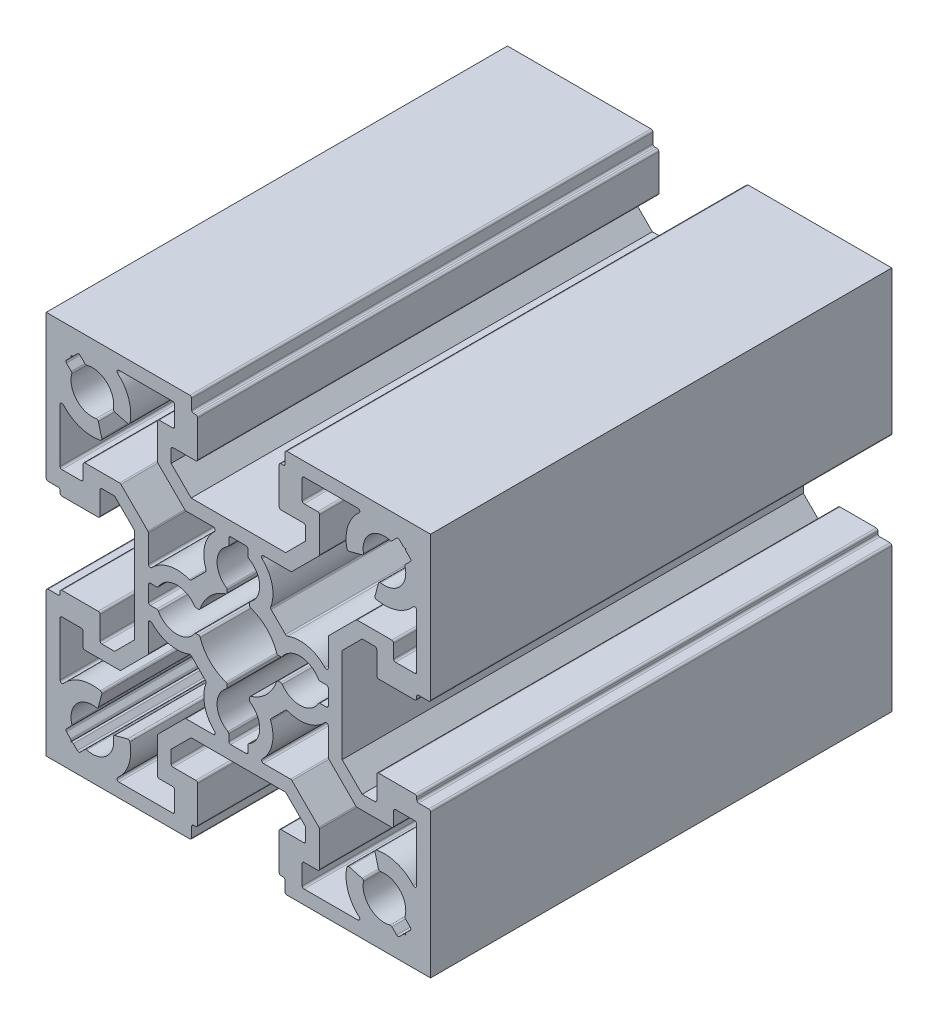
from build123d import *

# Parameters (mm, degrees)
Y_KSEKLIK_EKSTR_ZYON1_DEPTH = 60


with BuildPart() as part:
    # Çizim3 → Yükseklik-Ekstrüzyon1 (new body)
    with BuildSketch(Plane.XY):
        with BuildLine():
            Line((6.075, -23.45), (6.075, -24.75))
            ThreePointArc((6.075, -24.75), (6.148223305, -24.926776695), (6.325, -25))
            Line((6.325, -25), (25, -25))
            Line((25, -25), (25, -6.325))
            ThreePointArc((25, -6.325), (24.926776695, -6.148223305), (24.75, -6.075))
            Line((24.75, -6.075), (23.45, -6.075))
            ThreePointArc((23.45, -6.075), (23.273223305, -6.001776695), (23.2, -5.825))
            Line((23.2, -5.825), (23.2, -5.55))
            ThreePointArc((23.2, -5.55), (23.126776695, -5.373223305), (22.95, -5.3))
            Line((22.95, -5.3), (18.25, -5.3))
            ThreePointArc((18.25, -5.3), (18.073223305, -5.373223305), (18, -5.55))
            Line((18, -5.55), (18, -8.5))
            ThreePointArc((18, -8.5), (17.926776695, -8.676776695), (17.75, -8.75))
            Line((17.75, -8.75), (16.1, -8.75))
            Line((16.1, -8.75), (13.5, -6.15))
            Line((13.5, -6.15), (13.5, 6.15))
            Line((13.5, 6.15), (16.1, 8.75))
            Line((16.1, 8.75), (17.75, 8.75))
            ThreePointArc((17.75, 8.75), (17.926776695, 8.676776695), (18, 8.5))
            Line((18, 8.5), (18, 5.55))
            ThreePointArc((18, 5.55), (18.073223305, 5.373223305), (18.25, 5.3))
            Line((18.25, 5.3), (22.95, 5.3))
            ThreePointArc((22.95, 5.3), (23.126776695, 5.373223305), (23.2, 5.55))
            Line((23.2, 5.55), (23.2, 5.825))
            ThreePointArc((23.2, 5.825), (23.273223305, 6.001776695), (23.45, 6.075))
            Line((23.45, 6.075), (24.75, 6.075))
            ThreePointArc((24.75, 6.075), (24.926776695, 6.148223305), (25, 6.325))
            Line((25, 6.325), (25, 25))
            Line((25, 25), (6.325, 25))
            ThreePointArc((6.325, 25), (6.148223305, 24.926776695), (6.075, 24.75))
            Line((6.075, 24.75), (6.075, 23.45))
            ThreePointArc((6.075, 23.45), (6.001776695, 23.273223305), (5.825, 23.2))
            Line((5.825, 23.2), (5.55, 23.2))
            ThreePointArc((5.55, 23.2), (5.373223305, 23.126776695), (5.3, 22.95))
            Line((5.3, 22.95), (5.3, 18.25))
            ThreePointArc((5.3, 18.25), (5.373223305, 18.073223305), (5.55, 18))
            Line((5.55, 18), (8.5, 18))
            ThreePointArc((8.5, 18), (8.676776695, 17.926776695), (8.75, 17.75))
            Line((8.75, 17.75), (8.75, 16.1))
            Line((8.75, 16.1), (6.15, 13.5))
            Line((6.15, 13.5), (-6.15, 13.5))
            Line((-6.15, 13.5), (-8.75, 16.1))
            Line((-8.75, 16.1), (-8.75, 17.75))
            ThreePointArc((-8.75, 17.75), (-8.676776695, 17.926776695), (-8.5, 18))
            Line((-8.5, 18), (-5.55, 18))
            ThreePointArc((-5.55, 18), (-5.373223305, 18.073223305), (-5.3, 18.25))
            Line((-5.3, 18.25), (-5.3, 22.95))
            ThreePointArc((-5.3, 22.95), (-5.373223305, 23.126776695), (-5.55, 23.2))
            Line((-5.55, 23.2), (-5.825, 23.2))
            ThreePointArc((-5.825, 23.2), (-6.001776695, 23.273223305), (-6.075, 23.45))
            Line((-6.075, 23.45), (-6.075, 24.75))
            ThreePointArc((-6.075, 24.75), (-6.148223305, 24.926776695), (-6.325, 25))
            Line((-6.325, 25), (-25, 25))
            Line((-25, 25), (-25, 6.325))
            ThreePointArc((-25, 6.325), (-24.926776695, 6.148223305), (-24.75, 6.075))
            Line((-24.75, 6.075), (-23.45, 6.075))
            ThreePointArc((-23.45, 6.075), (-23.273223305, 6.001776695), (-23.2, 5.825))
            Line((-23.2, 5.825), (-23.2, 5.55))
            ThreePointArc((-23.2, 5.55), (-23.126776695, 5.373223305), (-22.95, 5.3))
            Line((-22.95, 5.3), (-18.25, 5.3))
            ThreePointArc((-18.25, 5.3), (-18.073223305, 5.373223305), (-18, 5.55))
            Line((-18, 5.55), (-18, 8.5))
            ThreePointArc((-18, 8.5), (-17.926776695, 8.676776695), (-17.75, 8.75))
            Line((-17.75, 8.75), (-16.1, 8.75))
            Line((-16.1, 8.75), (-13.5, 6.15))
            Line((-13.5, 6.15), (-13.5, -6.15))
            Line((-13.5, -6.15), (-16.1, -8.75))
            Line((-16.1, -8.75), (-17.75, -8.75))
            ThreePointArc((-17.75, -8.75), (-17.926776695, -8.676776695), (-18, -8.5))
            Line((-18, -8.5), (-18, -5.55))
            ThreePointArc((-18, -5.55), (-18.073223305, -5.373223305), (-18.25, -5.3))
            Line((-18.25, -5.3), (-22.95, -5.3))
            ThreePointArc((-22.95, -5.3), (-23.126776695, -5.373223305), (-23.2, -5.55))
            Line((-23.2, -5.55), (-23.2, -5.825))
            ThreePointArc((-23.2, -5.825), (-23.273223305, -6.001776695), (-23.45, -6.075))
            Line((-23.45, -6.075), (-24.75, -6.075))
            ThreePointArc((-24.75, -6.075), (-24.926776695, -6.148223305), (-25, -6.325))
            Line((-25, -6.325), (-25, -25))
            Line((-25, -25), (-6.325, -25))
            ThreePointArc((-6.325, -25), (-6.148223305, -24.926776695), (-6.075, -24.75))
            Line((-6.075, -24.75), (-6.075, -23.45))
            ThreePointArc((-6.075, -23.45), (-6.001776695, -23.273223305), (-5.825, -23.2))
            Line((-5.825, -23.2), (-5.55, -23.2))
            ThreePointArc((-5.55, -23.2), (-5.373223305, -23.126776695), (-5.3, -22.95))
            Line((-5.3, -22.95), (-5.3, -18.25))
            ThreePointArc((-5.3, -18.25), (-5.373223305, -18.073223305), (-5.55, -18))
            Line((-5.55, -18), (-8.5, -18))
            ThreePointArc((-8.5, -18), (-8.676776695, -17.926776695), (-8.75, -17.75))
            Line((-8.75, -17.75), (-8.75, -16.1))
            Line((-8.75, -16.1), (-6.15, -13.5))
            Line((-6.15, -13.5), (6.15, -13.5))
            Line((6.15, -13.5), (8.75, -16.1))
            Line((8.75, -16.1), (8.75, -17.75))
            ThreePointArc((8.75, -17.75), (8.676776695, -17.926776695), (8.5, -18))
            Line((8.5, -18), (5.55, -18))
            ThreePointArc((5.55, -18), (5.373223305, -18.073223305), (5.3, -18.25))
            Line((5.3, -18.25), (5.3, -22.95))
            ThreePointArc((5.3, -22.95), (5.373223305, -23.126776695), (5.55, -23.2))
            Line((5.55, -23.2), (5.825, -23.2))
            ThreePointArc((5.825, -23.2), (6.001776695, -23.273223305), (6.075, -23.45))
        make_face()
        with BuildLine():
            Line((1, -11.7), (-1, -11.7))
            ThreePointArc((-1, -11.7), (-1.176776695, -11.626776695), (-1.25, -11.45))
            Line((-1.25, -11.45), (-1.25, -10.626904071))
            ThreePointArc((-1.25, -10.626904071), (-1.283792073, -10.501388605), (-1.376033058, -10.409804561))
            ThreePointArc((-1.376033058, -10.409804561), (-2.772892693, -8.108125462), (-1.559504132, -5.704663018))
            ThreePointArc((-1.559504132, -5.704663018), (-1.479065658, -5.614871699), (-1.45, -5.497875902))
            Line((-1.45, -5.497875902), (-1.45, -5.20438517))
            ThreePointArc((-1.45, -5.20438517), (-1.497631039, -5.057596875), (-1.622374429, -4.966742012))
            ThreePointArc((-1.622374429, -4.966742012), (-3.694632932, -3.694632932), (-4.966742012, -1.622374429))
            ThreePointArc((-4.966742012, -1.622374429), (-5.057596875, -1.497631039), (-5.20438517, -1.45))
            Line((-5.20438517, -1.45), (-5.497875902, -1.45))
            ThreePointArc((-5.497875902, -1.45), (-5.614871699, -1.479065658), (-5.704663018, -1.559504132))
            ThreePointArc((-5.704663018, -1.559504132), (-8.108125462, -2.772892693), (-10.409804561, -1.376033058))
            ThreePointArc((-10.409804561, -1.376033058), (-10.501388605, -1.283792073), (-10.626904071, -1.25))
            Line((-10.626904071, -1.25), (-11.45, -1.25))
            ThreePointArc((-11.45, -1.25), (-11.626776695, -1.176776695), (-11.7, -1))
            Line((-11.7, -1), (-11.7, 1))
            ThreePointArc((-11.7, 1), (-11.626776695, 1.176776695), (-11.45, 1.25))
            Line((-11.45, 1.25), (-10.626904071, 1.25))
            ThreePointArc((-10.626904071, 1.25), (-10.501388605, 1.283792073), (-10.409804561, 1.376033058))
            ThreePointArc((-10.409804561, 1.376033058), (-8.108125462, 2.772892693), (-5.704663018, 1.559504132))
            ThreePointArc((-5.704663018, 1.559504132), (-5.614871699, 1.479065658), (-5.497875902, 1.45))
            Line((-5.497875902, 1.45), (-5.20438517, 1.45))
            ThreePointArc((-5.20438517, 1.45), (-5.057596875, 1.497631039), (-4.966742012, 1.622374429))
            ThreePointArc((-4.966742012, 1.622374429), (-3.694632932, 3.694632932), (-1.622374429, 4.966742012))
            ThreePointArc((-1.622374429, 4.966742012), (-1.497631039, 5.057596875), (-1.45, 5.20438517))
            Line((-1.45, 5.20438517), (-1.45, 5.497875902))
            ThreePointArc((-1.45, 5.497875902), (-1.479065658, 5.614871699), (-1.559504132, 5.704663018))
            ThreePointArc((-1.559504132, 5.704663018), (-2.772892693, 8.108125462), (-1.376033058, 10.409804561))
            ThreePointArc((-1.376033058, 10.409804561), (-1.283792073, 10.501388605), (-1.25, 10.626904071))
            Line((-1.25, 10.626904071), (-1.25, 11.45))
            ThreePointArc((-1.25, 11.45), (-1.176776695, 11.626776695), (-1, 11.7))
            Line((-1, 11.7), (1, 11.7))
            ThreePointArc((1, 11.7), (1.176776695, 11.626776695), (1.25, 11.45))
            Line((1.25, 11.45), (1.25, 10.626904071))
            ThreePointArc((1.25, 10.626904071), (1.283792073, 10.501388605), (1.376033058, 10.409804561))
            ThreePointArc((1.376033058, 10.409804561), (2.772892693, 8.108125462), (1.559504132, 5.704663018))
            ThreePointArc((1.559504132, 5.704663018), (1.479065658, 5.614871699), (1.45, 5.497875902))
            Line((1.45, 5.497875902), (1.45, 5.20438517))
            ThreePointArc((1.45, 5.20438517), (1.497631039, 5.057596875), (1.622374429, 4.966742012))
            ThreePointArc((1.622374429, 4.966742012), (3.694632932, 3.694632932), (4.966742012, 1.622374429))
            ThreePointArc((4.966742012, 1.622374429), (5.057596875, 1.497631039), (5.20438517, 1.45))
            Line((5.20438517, 1.45), (5.497875902, 1.45))
            ThreePointArc((5.497875902, 1.45), (5.614871699, 1.479065658), (5.704663018, 1.559504132))
            ThreePointArc((5.704663018, 1.559504132), (8.108125462, 2.772892693), (10.409804561, 1.376033058))
            ThreePointArc((10.409804561, 1.376033058), (10.501388605, 1.283792073), (10.626904071, 1.25))
            Line((10.626904071, 1.25), (11.45, 1.25))
            ThreePointArc((11.45, 1.25), (11.626776695, 1.176776695), (11.7, 1))
            Line((11.7, 1), (11.7, -1))
            ThreePointArc((11.7, -1), (11.626776695, -1.176776695), (11.45, -1.25))
            Line((11.45, -1.25), (10.626904071, -1.25))
            ThreePointArc((10.626904071, -1.25), (10.501388605, -1.283792073), (10.409804561, -1.376033058))
            ThreePointArc((10.409804561, -1.376033058), (8.108125462, -2.772892693), (5.704663018, -1.559504132))
            ThreePointArc((5.704663018, -1.559504132), (5.614871699, -1.479065658), (5.497875902, -1.45))
            Line((5.497875902, -1.45), (5.20438517, -1.45))
            ThreePointArc((5.20438517, -1.45), (5.057596875, -1.497631039), (4.966742012, -1.622374429))
            ThreePointArc((4.966742012, -1.622374429), (3.694632932, -3.694632932), (1.622374429, -4.966742012))
            ThreePointArc((1.622374429, -4.966742012), (1.497631039, -5.057596875), (1.45, -5.20438517))
            Line((1.45, -5.20438517), (1.45, -5.497875902))
            ThreePointArc((1.45, -5.497875902), (1.479065658, -5.614871699), (1.559504132, -5.704663018))
            ThreePointArc((1.559504132, -5.704663018), (2.772892693, -8.108125462), (1.376033058, -10.409804561))
            ThreePointArc((1.376033058, -10.409804561), (1.283792073, -10.501388605), (1.25, -10.626904071))
            Line((1.25, -10.626904071), (1.25, -11.45))
            ThreePointArc((1.25, -11.45), (1.176776695, -11.626776695), (1, -11.7))
        make_face(mode=Mode.SUBTRACT)
        with BuildLine():
            Line((4.262090841, -6.132378842), (6.132378842, -4.262090841))
            ThreePointArc((6.132378842, -4.262090841), (6.2568634, -4.194397636), (6.398147352, -4.205242929))
            ThreePointArc((6.398147352, -4.205242929), (9.001780412, -4.38707602), (11.268421053, -3.093125252))
            ThreePointArc((11.268421053, -3.093125252), (11.542480439, -3.032699815), (11.7, -3.264965543))
            Line((11.7, -3.264965543), (11.7, -6.792031022))
            ThreePointArc((11.7, -6.792031022), (11.719030117, -6.88770188), (11.773223305, -6.968807717))
            Line((11.773223305, -6.968807717), (15.281192283, -10.476776695))
            ThreePointArc((15.281192283, -10.476776695), (15.36229812, -10.530969883), (15.457968978, -10.55))
            Line((15.457968978, -10.55), (19.95, -10.55))
            ThreePointArc((19.95, -10.55), (20.126776695, -10.476776695), (20.2, -10.3))
            Line((20.2, -10.3), (20.2, -8.55))
            ThreePointArc((20.2, -8.55), (20.273223305, -8.373223305), (20.45, -8.3))
            Line((20.45, -8.3), (22.95, -8.3))
            ThreePointArc((22.95, -8.3), (23.126776695, -8.373223305), (23.2, -8.55))
            Line((23.2, -8.55), (23.2, -15.541676707))
            ThreePointArc((23.2, -15.541676707), (23.037966444, -15.775689324), (22.761904762, -15.706358768))
            ThreePointArc((22.761904762, -15.706358768), (20.578825127, -14.255812902), (17.9618894, -14.108954469))
            ThreePointArc((17.9618894, -14.108954469), (17.800654226, -14.222850555), (17.772313473, -14.418211507))
            Line((17.772313473, -14.418211507), (18.21975072, -16.088070045))
            ThreePointArc((18.21975072, -16.088070045), (18.327384922, -16.234516681), (18.505758443, -16.269368153))
            ThreePointArc((18.505758443, -16.269368153), (21.046167212, -17.125480131), (21.676991453, -19.73098684))
            ThreePointArc((21.676991453, -19.73098684), (21.676526925, -19.860970765), (21.741385159, -19.973618206))
            Line((21.741385159, -19.973618206), (22.358757211, -20.590990258))
            ThreePointArc((22.358757211, -20.590990258), (22.431980515, -20.767766953), (22.358757211, -20.944543648))
            Line((22.358757211, -20.944543648), (21.828427125, -21.474873734))
            ThreePointArc((21.828427125, -21.474873734), (21.75520382, -21.651650429), (21.828427125, -21.828427125))
            ThreePointArc((21.828427125, -21.828427125), (21.651650429, -21.75520382), (21.474873734, -21.828427125))
            Line((21.474873734, -21.828427125), (20.944543648, -22.358757211))
            ThreePointArc((20.944543648, -22.358757211), (20.767766953, -22.431980515), (20.590990258, -22.358757211))
            Line((20.590990258, -22.358757211), (19.973618206, -21.741385159))
            ThreePointArc((19.973618206, -21.741385159), (19.860970765, -21.676526925), (19.73098684, -21.676991453))
            ThreePointArc((19.73098684, -21.676991453), (17.125480131, -21.046167212), (16.269368153, -18.505758443))
            ThreePointArc((16.269368153, -18.505758443), (16.234516681, -18.327384922), (16.088070045, -18.21975072))
            Line((16.088070045, -18.21975072), (14.418211507, -17.772313473))
            ThreePointArc((14.418211507, -17.772313473), (14.222850555, -17.800654226), (14.108954469, -17.9618894))
            ThreePointArc((14.108954469, -17.9618894), (14.255812902, -20.578825127), (15.706358768, -22.761904762))
            ThreePointArc((15.706358768, -22.761904762), (15.775689324, -23.037966444), (15.541676707, -23.2))
            Line((15.541676707, -23.2), (8.55, -23.2))
            ThreePointArc((8.55, -23.2), (8.373223305, -23.126776695), (8.3, -22.95))
            Line((8.3, -22.95), (8.3, -20.45))
            ThreePointArc((8.3, -20.45), (8.373223305, -20.273223305), (8.55, -20.2))
            Line((8.55, -20.2), (10.3, -20.2))
            ThreePointArc((10.3, -20.2), (10.476776695, -20.126776695), (10.55, -19.95))
            Line((10.55, -19.95), (10.55, -15.457968978))
            ThreePointArc((10.55, -15.457968978), (10.530969883, -15.36229812), (10.476776695, -15.281192283))
            Line((10.476776695, -15.281192283), (6.968807717, -11.773223305))
            ThreePointArc((6.968807717, -11.773223305), (6.88770188, -11.719030117), (6.792031022, -11.7))
            Line((6.792031022, -11.7), (3.264965543, -11.7))
            ThreePointArc((3.264965543, -11.7), (3.032699815, -11.542480439), (3.093125252, -11.268421053))
            ThreePointArc((3.093125252, -11.268421053), (4.38707602, -9.001780412), (4.205242929, -6.398147352))
            ThreePointArc((4.205242929, -6.398147352), (4.194397636, -6.2568634), (4.262090841, -6.132378842))
        make_face(mode=Mode.SUBTRACT)
        with BuildLine():
            Line((-20.944543648, -22.358757211), (-21.474873734, -21.828427125))
            ThreePointArc((-21.474873734, -21.828427125), (-21.651650429, -21.75520382), (-21.828427125, -21.828427125))
            ThreePointArc((-21.828427125, -21.828427125), (-21.75520382, -21.651650429), (-21.828427125, -21.474873734))
            Line((-21.828427125, -21.474873734), (-22.358757211, -20.944543648))
            ThreePointArc((-22.358757211, -20.944543648), (-22.431980515, -20.767766953), (-22.358757211, -20.590990258))
            Line((-22.358757211, -20.590990258), (-21.741385159, -19.973618206))
            ThreePointArc((-21.741385159, -19.973618206), (-21.676526925, -19.860970765), (-21.676991453, -19.73098684))
            ThreePointArc((-21.676991453, -19.73098684), (-21.046167212, -17.125480131), (-18.505758443, -16.269368153))
            ThreePointArc((-18.505758443, -16.269368153), (-18.327384922, -16.234516681), (-18.21975072, -16.088070045))
            Line((-18.21975072, -16.088070045), (-17.772313473, -14.418211507))
            ThreePointArc((-17.772313473, -14.418211507), (-17.800654226, -14.222850555), (-17.9618894, -14.108954469))
            ThreePointArc((-17.9618894, -14.108954469), (-20.578825127, -14.255812902), (-22.761904762, -15.706358768))
            ThreePointArc((-22.761904762, -15.706358768), (-23.037966444, -15.775689324), (-23.2, -15.541676707))
            Line((-23.2, -15.541676707), (-23.2, -8.55))
            ThreePointArc((-23.2, -8.55), (-23.126776695, -8.373223305), (-22.95, -8.3))
            Line((-22.95, -8.3), (-20.45, -8.3))
            ThreePointArc((-20.45, -8.3), (-20.273223305, -8.373223305), (-20.2, -8.55))
            Line((-20.2, -8.55), (-20.2, -10.3))
            ThreePointArc((-20.2, -10.3), (-20.126776695, -10.476776695), (-19.95, -10.55))
            Line((-19.95, -10.55), (-15.457968978, -10.55))
            ThreePointArc((-15.457968978, -10.55), (-15.36229812, -10.530969883), (-15.281192283, -10.476776695))
            Line((-15.281192283, -10.476776695), (-11.773223305, -6.968807717))
            ThreePointArc((-11.773223305, -6.968807717), (-11.719030117, -6.88770188), (-11.7, -6.792031022))
            Line((-11.7, -6.792031022), (-11.7, -3.264965543))
            ThreePointArc((-11.7, -3.264965543), (-11.542480439, -3.032699815), (-11.268421053, -3.093125252))
            ThreePointArc((-11.268421053, -3.093125252), (-9.001780412, -4.38707602), (-6.398147352, -4.205242929))
            ThreePointArc((-6.398147352, -4.205242929), (-6.2568634, -4.194397636), (-6.132378842, -4.262090841))
            Line((-6.132378842, -4.262090841), (-4.262090841, -6.132378842))
            ThreePointArc((-4.262090841, -6.132378842), (-4.194397636, -6.2568634), (-4.205242929, -6.398147352))
            ThreePointArc((-4.205242929, -6.398147352), (-4.38707602, -9.001780412), (-3.093125252, -11.268421053))
            ThreePointArc((-3.093125252, -11.268421053), (-3.032699815, -11.542480439), (-3.264965543, -11.7))
            Line((-3.264965543, -11.7), (-6.792031022, -11.7))
            ThreePointArc((-6.792031022, -11.7), (-6.88770188, -11.719030117), (-6.968807717, -11.773223305))
            Line((-6.968807717, -11.773223305), (-10.476776695, -15.281192283))
            ThreePointArc((-10.476776695, -15.281192283), (-10.530969883, -15.36229812), (-10.55, -15.457968978))
            Line((-10.55, -15.457968978), (-10.55, -19.95))
            ThreePointArc((-10.55, -19.95), (-10.476776695, -20.126776695), (-10.3, -20.2))
            Line((-10.3, -20.2), (-8.55, -20.2))
            ThreePointArc((-8.55, -20.2), (-8.373223305, -20.273223305), (-8.3, -20.45))
            Line((-8.3, -20.45), (-8.3, -22.95))
            ThreePointArc((-8.3, -22.95), (-8.373223305, -23.126776695), (-8.55, -23.2))
            Line((-8.55, -23.2), (-15.541676707, -23.2))
            ThreePointArc((-15.541676707, -23.2), (-15.775689324, -23.037966444), (-15.706358768, -22.761904762))
            ThreePointArc((-15.706358768, -22.761904762), (-14.255812902, -20.578825127), (-14.108954469, -17.9618894))
            ThreePointArc((-14.108954469, -17.9618894), (-14.222850555, -17.800654226), (-14.418211507, -17.772313473))
            Line((-14.418211507, -17.772313473), (-16.088070045, -18.21975072))
            ThreePointArc((-16.088070045, -18.21975072), (-16.234516681, -18.327384922), (-16.269368153, -18.505758443))
            ThreePointArc((-16.269368153, -18.505758443), (-17.125480131, -21.046167212), (-19.73098684, -21.676991453))
            ThreePointArc((-19.73098684, -21.676991453), (-19.860970765, -21.676526925), (-19.973618206, -21.741385159))
            Line((-19.973618206, -21.741385159), (-20.590990258, -22.358757211))
            ThreePointArc((-20.590990258, -22.358757211), (-20.767766953, -22.431980515), (-20.944543648, -22.358757211))
        make_face(mode=Mode.SUBTRACT)
        with BuildLine():
            Line((-22.358757211, 20.944543648), (-21.828427125, 21.474873734))
            ThreePointArc((-21.828427125, 21.474873734), (-21.75520382, 21.651650429), (-21.828427125, 21.828427125))
            ThreePointArc((-21.828427125, 21.828427125), (-21.651650429, 21.75520382), (-21.474873734, 21.828427125))
            Line((-21.474873734, 21.828427125), (-20.944543648, 22.358757211))
            ThreePointArc((-20.944543648, 22.358757211), (-20.767766953, 22.431980515), (-20.590990258, 22.358757211))
            Line((-20.590990258, 22.358757211), (-19.973618206, 21.741385159))
            ThreePointArc((-19.973618206, 21.741385159), (-19.860970765, 21.676526925), (-19.73098684, 21.676991453))
            ThreePointArc((-19.73098684, 21.676991453), (-17.125480131, 21.046167212), (-16.269368153, 18.505758443))
            ThreePointArc((-16.269368153, 18.505758443), (-16.234516681, 18.327384922), (-16.088070045, 18.21975072))
            Line((-16.088070045, 18.21975072), (-14.418211507, 17.772313473))
            ThreePointArc((-14.418211507, 17.772313473), (-14.222850555, 17.800654226), (-14.108954469, 17.9618894))
            ThreePointArc((-14.108954469, 17.9618894), (-14.255812902, 20.578825127), (-15.706358768, 22.761904762))
            ThreePointArc((-15.706358768, 22.761904762), (-15.775689324, 23.037966444), (-15.541676707, 23.2))
            Line((-15.541676707, 23.2), (-8.55, 23.2))
            ThreePointArc((-8.55, 23.2), (-8.373223305, 23.126776695), (-8.3, 22.95))
            Line((-8.3, 22.95), (-8.3, 20.45))
            ThreePointArc((-8.3, 20.45), (-8.373223305, 20.273223305), (-8.55, 20.2))
            Line((-8.55, 20.2), (-10.3, 20.2))
            ThreePointArc((-10.3, 20.2), (-10.476776695, 20.126776695), (-10.55, 19.95))
            Line((-10.55, 19.95), (-10.55, 15.457968978))
            ThreePointArc((-10.55, 15.457968978), (-10.530969883, 15.36229812), (-10.476776695, 15.281192283))
            Line((-10.476776695, 15.281192283), (-6.968807717, 11.773223305))
            ThreePointArc((-6.968807717, 11.773223305), (-6.88770188, 11.719030117), (-6.792031022, 11.7))
            Line((-6.792031022, 11.7), (-3.264965543, 11.7))
            ThreePointArc((-3.264965543, 11.7), (-3.032699815, 11.542480439), (-3.093125252, 11.268421053))
            ThreePointArc((-3.093125252, 11.268421053), (-4.38707602, 9.001780412), (-4.205242929, 6.398147352))
            ThreePointArc((-4.205242929, 6.398147352), (-4.194397636, 6.2568634), (-4.262090841, 6.132378842))
            Line((-4.262090841, 6.132378842), (-6.132378842, 4.262090841))
            ThreePointArc((-6.132378842, 4.262090841), (-6.2568634, 4.194397636), (-6.398147352, 4.205242929))
            ThreePointArc((-6.398147352, 4.205242929), (-9.001780412, 4.38707602), (-11.268421053, 3.093125252))
            ThreePointArc((-11.268421053, 3.093125252), (-11.542480439, 3.032699815), (-11.7, 3.264965543))
            Line((-11.7, 3.264965543), (-11.7, 6.792031022))
            ThreePointArc((-11.7, 6.792031022), (-11.719030117, 6.88770188), (-11.773223305, 6.968807717))
            Line((-11.773223305, 6.968807717), (-15.281192283, 10.476776695))
            ThreePointArc((-15.281192283, 10.476776695), (-15.36229812, 10.530969883), (-15.457968978, 10.55))
            Line((-15.457968978, 10.55), (-19.95, 10.55))
            ThreePointArc((-19.95, 10.55), (-20.126776695, 10.476776695), (-20.2, 10.3))
            Line((-20.2, 10.3), (-20.2, 8.55))
            ThreePointArc((-20.2, 8.55), (-20.273223305, 8.373223305), (-20.45, 8.3))
            Line((-20.45, 8.3), (-22.95, 8.3))
            ThreePointArc((-22.95, 8.3), (-23.126776695, 8.373223305), (-23.2, 8.55))
            Line((-23.2, 8.55), (-23.2, 15.541676707))
            ThreePointArc((-23.2, 15.541676707), (-23.037966444, 15.775689324), (-22.761904762, 15.706358768))
            ThreePointArc((-22.761904762, 15.706358768), (-20.578825127, 14.255812902), (-17.9618894, 14.108954469))
            ThreePointArc((-17.9618894, 14.108954469), (-17.800654226, 14.222850555), (-17.772313473, 14.418211507))
            Line((-17.772313473, 14.418211507), (-18.21975072, 16.088070045))
            ThreePointArc((-18.21975072, 16.088070045), (-18.327384922, 16.234516681), (-18.505758443, 16.269368153))
            ThreePointArc((-18.505758443, 16.269368153), (-21.046167212, 17.125480131), (-21.676991453, 19.73098684))
            ThreePointArc((-21.676991453, 19.73098684), (-21.676526925, 19.860970765), (-21.741385159, 19.973618206))
            Line((-21.741385159, 19.973618206), (-22.358757211, 20.590990258))
            ThreePointArc((-22.358757211, 20.590990258), (-22.431980515, 20.767766953), (-22.358757211, 20.944543648))
        make_face(mode=Mode.SUBTRACT)
        with BuildLine():
            Line((20.944543648, 22.358757211), (21.474873734, 21.828427125))
            ThreePointArc((21.474873734, 21.828427125), (21.651650429, 21.75520382), (21.828427125, 21.828427125))
            ThreePointArc((21.828427125, 21.828427125), (21.75520382, 21.651650429), (21.828427125, 21.474873734))
            Line((21.828427125, 21.474873734), (22.358757211, 20.944543648))
            ThreePointArc((22.358757211, 20.944543648), (22.431980515, 20.767766953), (22.358757211, 20.590990258))
            Line((22.358757211, 20.590990258), (21.741385159, 19.973618206))
            ThreePointArc((21.741385159, 19.973618206), (21.676526925, 19.860970765), (21.676991453, 19.73098684))
            ThreePointArc((21.676991453, 19.73098684), (21.046167212, 17.125480131), (18.505758443, 16.269368153))
            ThreePointArc((18.505758443, 16.269368153), (18.327384922, 16.234516681), (18.21975072, 16.088070045))
            Line((18.21975072, 16.088070045), (17.772313473, 14.418211507))
            ThreePointArc((17.772313473, 14.418211507), (17.800654226, 14.222850555), (17.9618894, 14.108954469))
            ThreePointArc((17.9618894, 14.108954469), (20.578825127, 14.255812902), (22.761904762, 15.706358768))
            ThreePointArc((22.761904762, 15.706358768), (23.037966444, 15.775689324), (23.2, 15.541676707))
            Line((23.2, 15.541676707), (23.2, 8.55))
            ThreePointArc((23.2, 8.55), (23.126776695, 8.373223305), (22.95, 8.3))
            Line((22.95, 8.3), (20.45, 8.3))
            ThreePointArc((20.45, 8.3), (20.273223305, 8.373223305), (20.2, 8.55))
            Line((20.2, 8.55), (20.2, 10.3))
            ThreePointArc((20.2, 10.3), (20.126776695, 10.476776695), (19.95, 10.55))
            Line((19.95, 10.55), (15.457968978, 10.55))
            ThreePointArc((15.457968978, 10.55), (15.36229812, 10.530969883), (15.281192283, 10.476776695))
            Line((15.281192283, 10.476776695), (11.773223305, 6.968807717))
            ThreePointArc((11.773223305, 6.968807717), (11.719030117, 6.88770188), (11.7, 6.792031022))
            Line((11.7, 6.792031022), (11.7, 3.264965543))
            ThreePointArc((11.7, 3.264965543), (11.542480439, 3.032699815), (11.268421053, 3.093125252))
            ThreePointArc((11.268421053, 3.093125252), (9.001780412, 4.38707602), (6.398147352, 4.205242929))
            ThreePointArc((6.398147352, 4.205242929), (6.2568634, 4.194397636), (6.132378842, 4.262090841))
            Line((6.132378842, 4.262090841), (4.262090841, 6.132378842))
            ThreePointArc((4.262090841, 6.132378842), (4.194397636, 6.2568634), (4.205242929, 6.398147352))
            ThreePointArc((4.205242929, 6.398147352), (4.38707602, 9.001780412), (3.093125252, 11.268421053))
            ThreePointArc((3.093125252, 11.268421053), (3.032699815, 11.542480439), (3.264965543, 11.7))
            Line((3.264965543, 11.7), (6.792031022, 11.7))
            ThreePointArc((6.792031022, 11.7), (6.88770188, 11.719030117), (6.968807717, 11.773223305))
            Line((6.968807717, 11.773223305), (10.476776695, 15.281192283))
            ThreePointArc((10.476776695, 15.281192283), (10.530969883, 15.36229812), (10.55, 15.457968978))
            Line((10.55, 15.457968978), (10.55, 19.95))
            ThreePointArc((10.55, 19.95), (10.476776695, 20.126776695), (10.3, 20.2))
            Line((10.3, 20.2), (8.55, 20.2))
            ThreePointArc((8.55, 20.2), (8.373223305, 20.273223305), (8.3, 20.45))
            Line((8.3, 20.45), (8.3, 22.95))
            ThreePointArc((8.3, 22.95), (8.373223305, 23.126776695), (8.55, 23.2))
            Line((8.55, 23.2), (15.541676707, 23.2))
            ThreePointArc((15.541676707, 23.2), (15.775689324, 23.037966444), (15.706358768, 22.761904762))
            ThreePointArc((15.706358768, 22.761904762), (14.255812902, 20.578825127), (14.108954469, 17.9618894))
            ThreePointArc((14.108954469, 17.9618894), (14.222850555, 17.800654226), (14.418211507, 17.772313473))
            Line((14.418211507, 17.772313473), (16.088070045, 18.21975072))
            ThreePointArc((16.088070045, 18.21975072), (16.234516681, 18.327384922), (16.269368153, 18.505758443))
            ThreePointArc((16.269368153, 18.505758443), (17.125480131, 21.046167212), (19.73098684, 21.676991453))
            ThreePointArc((19.73098684, 21.676991453), (19.860970765, 21.676526925), (19.973618206, 21.741385159))
            Line((19.973618206, 21.741385159), (20.590990258, 22.358757211))
            ThreePointArc((20.590990258, 22.358757211), (20.767766953, 22.431980515), (20.944543648, 22.358757211))
        make_face(mode=Mode.SUBTRACT)
    extrude(amount=Y_KSEKLIK_EKSTR_ZYON1_DEPTH)


solid = part.part
